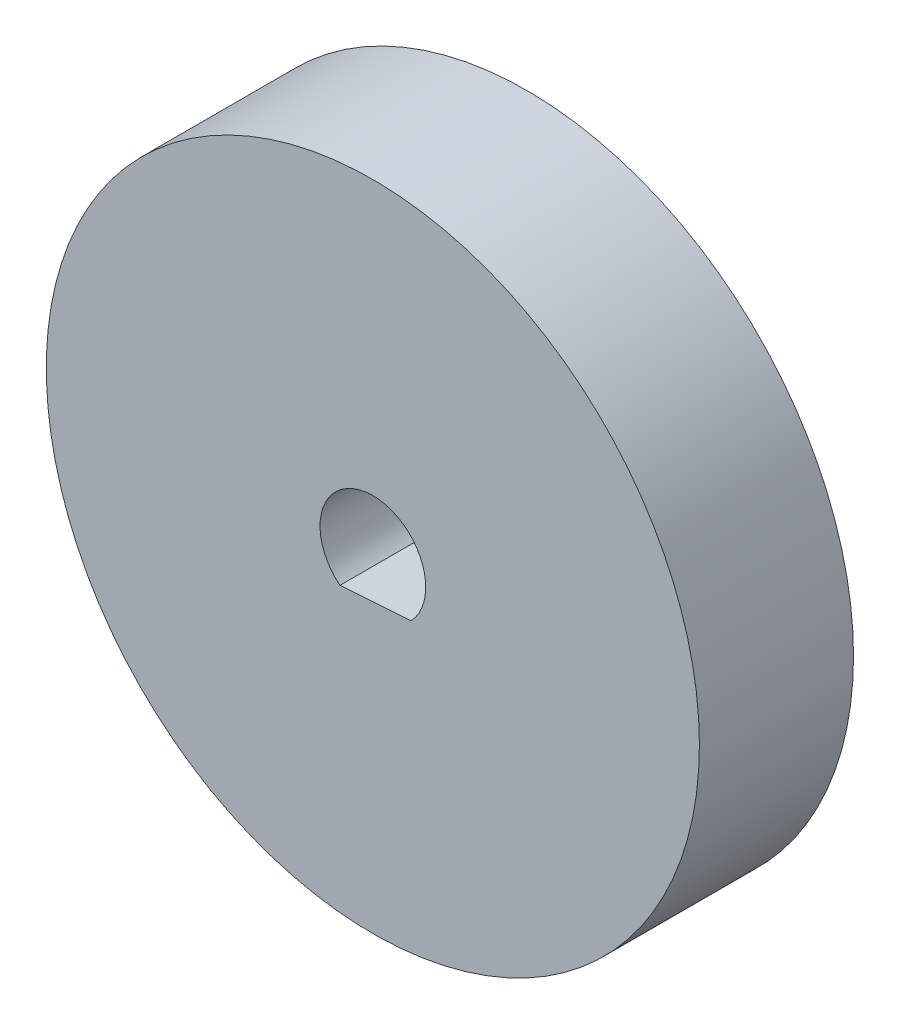
from build123d import *

# Parameters (mm, degrees)
SKETCH1_R           = 11.303
BOSS_EXTRUDE1_DEPTH = 5.334
CUT_EXTRUDE1_DEPTH  = 23.403000796


with BuildPart() as part:
    # Sketch1 → Boss-Extrude1 (new body)
    with BuildSketch(Plane.XY):
        with Locations((0, 7.2896082)):
            Circle(SKETCH1_R)
    extrude(amount=BOSS_EXTRUDE1_DEPTH)

    # Sketch2 → Cut-Extrude1 (cut, through all)
    with BuildSketch(Plane(origin=(0, 0, 0), x_dir=(-1, 0, 0), z_dir=(0, 0, -1))):
        with BuildLine():
            ThreePointArc((1.8288, 7.2896082), (-0.679551532, 8.987465425), (-1.323780003, 6.027817432))
            Line((-1.323780003, 6.027817432), (1.137751433, 5.857815227))
            ThreePointArc((1.137751433, 5.857815227), (1.647001709, 6.494690085), (1.8288, 7.2896082))
        make_face()
    extrude(amount=-CUT_EXTRUDE1_DEPTH, mode=Mode.SUBTRACT)


solid = part.part
